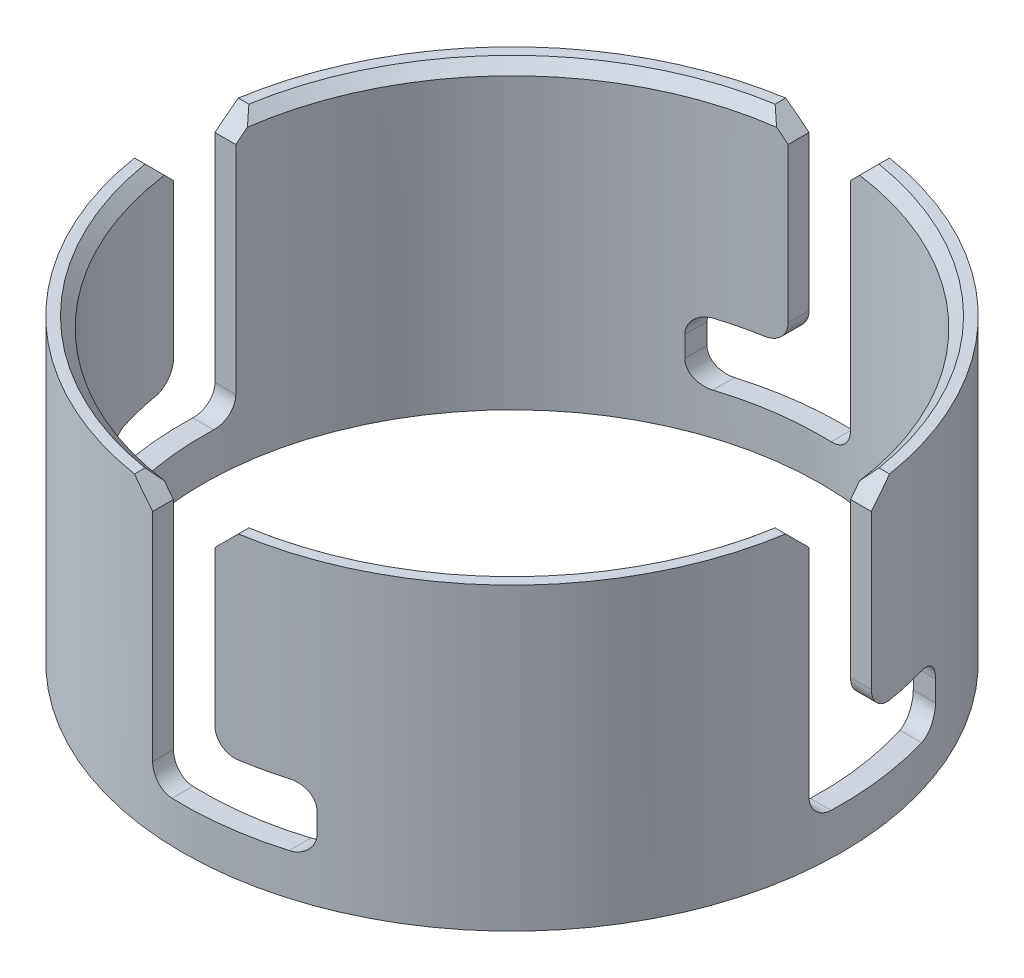
from build123d import *

# Parameters (mm, degrees)
SKETCH2_W                    = 5
SKETCH2_H                    = 72.15
CUT_EXTRUDE1_DEPTH           = 134.440637551
FILLET1_R                    = 5
CHAMFER1_SIZE                = 5
FILLET3_R                    = 5
CIRPATTERN1_COUNT            = 4
FILLET1_OF_CIRPATTERN1_R     = 5
CHAMFER1_OF_CIRPATTERN1_SIZE = 5
FILLET3_OF_CIRPATTERN1_R     = 5
CHAMFER2_SIZE                = 2.5


with BuildPart() as part:
    # Sketch2 → Revolve1 (revolve)
    with BuildSketch(Plane(origin=(0, 0, 0), x_dir=(0, 0, -1), z_dir=(1, 0, 0))):
        with Locations((-76.875, 36.075)):
            Rectangle(SKETCH2_W, SKETCH2_H)
    revolve(axis=Axis((0, -3.6075, 0), (0, 1, 0)))

    # Sketch3 → Cut-Extrude1 (cut, through all)
    with BuildSketch(Plane(origin=(0, 0, 0), x_dir=(0, 0, -1), z_dir=(1, 0, 0))):
        Polygon((-7.5, 72.15), (7.5, 72.15), (7.5, 10), (-27.5, 10), (-27.5, 25), (-7.5, 25), align=None)
    cut_extrude1 = extrude(amount=-CUT_EXTRUDE1_DEPTH, mode=Mode.SUBTRACT)

    # Fillet1
    fillet1_edges = [part.edges().sort_by_distance(p)[0] for p in [
        (-76.50787868, 25, 7.5),
        (-76.50787868, 10, -7.5),
    ]]
    fillet(fillet1_edges, radius=FILLET1_R)

    # Chamfer1
    chamfer1_edges = [part.edges().sort_by_distance(p)[0] for p in [
        (-76.50787868, 72.15, 7.5),
        (-76.50787868, 72.15, -7.5),
    ]]
    chamfer(chamfer1_edges, length=CHAMFER1_SIZE)

    # Fillet3
    fillet3_edges = [part.edges().sort_by_distance(p)[0] for p in [
        (-71.781593702, 25, 27.5),
        (-71.781593702, 10, 27.5),
    ]]
    fillet(fillet3_edges, radius=FILLET3_R)

    # CirPattern1: Cut-Extrude1 ×4 about axis
    cirpattern1_axis = Axis((0, -3.6075, 0), (0, 1, 0))
    for i in range(1, CIRPATTERN1_COUNT):
        add(cut_extrude1.rotate(cirpattern1_axis, i * 360 / CIRPATTERN1_COUNT), mode=Mode.SUBTRACT)

    # Fillet1 of CirPattern1
    fillet1_of_cirpattern1_edges = [part.edges().sort_by_distance(p)[0] for p in [
        (7.5, 25, 76.50787868),
        (-7.5, 10, 76.50787868),
        (76.50787868, 25, -7.5),
        (76.50787868, 10, 7.5),
        (-7.5, 25, -76.50787868),
        (7.5, 10, -76.50787868),
    ]]
    fillet(fillet1_of_cirpattern1_edges, radius=FILLET1_OF_CIRPATTERN1_R)

    # Chamfer1 of CirPattern1
    chamfer1_of_cirpattern1_edges = [part.edges().sort_by_distance(p)[0] for p in [
        (7.5, 72.15, 76.50787868),
        (-7.5, 72.15, 76.50787868),
        (76.50787868, 72.15, -7.5),
        (76.50787868, 72.15, 7.5),
        (-7.5, 72.15, -76.50787868),
        (7.5, 72.15, -76.50787868),
    ]]
    chamfer(chamfer1_of_cirpattern1_edges, length=CHAMFER1_OF_CIRPATTERN1_SIZE)

    # Fillet3 of CirPattern1
    fillet3_of_cirpattern1_edges = [part.edges().sort_by_distance(p)[0] for p in [
        (27.5, 25, 71.781593702),
        (27.5, 10, 71.781593702),
        (71.781593702, 25, -27.5),
        (71.781593702, 10, -27.5),
        (-27.5, 25, -71.781593702),
        (-27.5, 10, -71.781593702),
    ]]
    fillet(fillet3_of_cirpattern1_edges, radius=FILLET3_OF_CIRPATTERN1_R)

    # Chamfer2
    chamfer2_edges = [part.edges().sort_by_distance(p)[0] for p in [
        (-52.591066851, 72.15, -52.591066851),
        (52.591066851, 72.15, -52.591066851),
        (52.591066851, 72.15, 52.591066851),
        (-52.591066851, 72.15, 52.591066851),
    ]]
    chamfer(chamfer2_edges, length=CHAMFER2_SIZE)


solid = part.part
